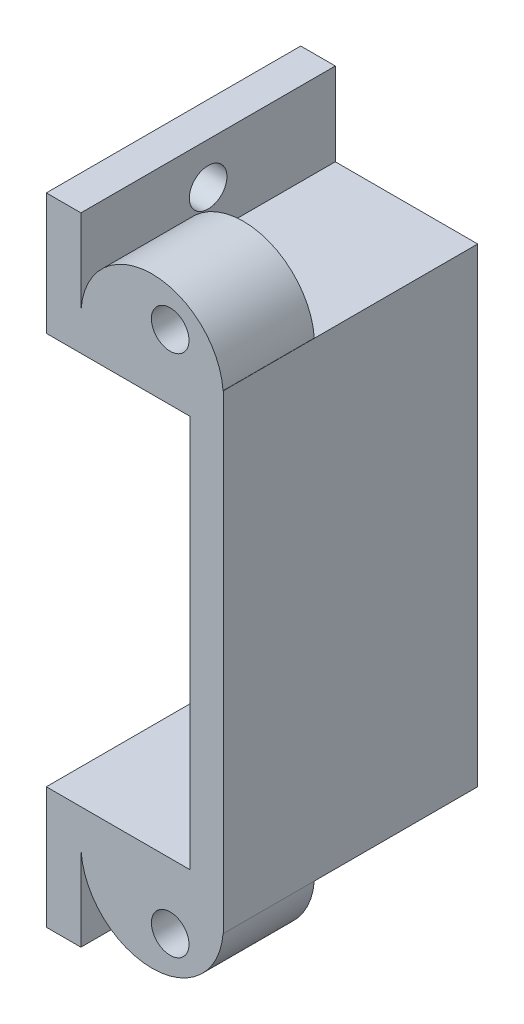
from build123d import *

# Parameters (mm, degrees)
BOSS_EXTRUDE1_DEPTH = 23
SKETCH2_R           = 1.7
CUT_EXTRUDE1_DEPTH  = 39.81958977
CUT_EXTRUDE5_START  = 23
SKETCH2_8_W         = 14.75
SKETCH2_8_H         = 7
SKETCH2_8_R         = 1.7
CUT_EXTRUDE5_DEPTH  = 23
SKETCH5_R           = 1.7
CUT_EXTRUDE6_DEPTH  = 41.323690307
SKETCH6_R           = 1.7
CUT_EXTRUDE7_DEPTH  = 23


with BuildPart() as part:
    # Sketch1 → Boss-Extrude1 (new body)
    with BuildSketch(Plane.XY):
        with BuildLine():
            Line((13, 18), (13, -18))
            Line((13, -18), (0, -18))
            Line((0, -18), (0, -28.5))
            Line((0, -28.5), (3.127139018, -28.5))
            Line((3.127139018, -28.5), (3.127139018, -21))
            Line((3.127139018, -21), (16, -21))
            Line((16, -21), (16, 21))
            ThreePointArc((16, 21), (9.563569509, 27.436430491), (3.127139018, 21))
            Line((3.127139018, 21), (3.127139018, 28.5))
            Line((3.127139018, 28.5), (0, 28.5))
            Line((0, 28.5), (0, 18))
            Line((0, 18), (13, 18))
        make_face()
    boss_extrude1 = extrude(amount=BOSS_EXTRUDE1_DEPTH)

    # Sketch2 → Cut-Extrude1 (cut, symmetric)
    with BuildSketch(Plane(origin=(3.127139018, 0, 0), x_dir=(0, 0, -1), z_dir=(1, 0, 0))):
        with Locations((-11.5, 24.75)):
            Circle(SKETCH2_R)
    cut_extrude1 = extrude(amount=CUT_EXTRUDE1_DEPTH, both=True, mode=Mode.SUBTRACT)

    # Sketch2<8> → Cut-Extrude5 (cut)
    with BuildSketch(Plane(origin=(3.127139018, 0, 0), x_dir=(0, 0, -1), z_dir=(1, 0, 0)).offset(CUT_EXTRUDE5_START)):
        with Locations((-7.375, 25)):
            Rectangle(SKETCH2_8_W, SKETCH2_8_H)
        with Locations((-11.5, 24.75)):
            Circle(SKETCH2_8_R, mode=Mode.SUBTRACT)
    cut_extrude5 = extrude(amount=-CUT_EXTRUDE5_DEPTH, mode=Mode.SUBTRACT)

    # Mirror5: Boss-Extrude1, Cut-Extrude1, Cut-Extrude5 across plane
    add(boss_extrude1.mirror(Plane(origin=(0, 0.25, 0), x_dir=(0, 0, 1), z_dir=(0, -1, 0))))
    add(cut_extrude1.mirror(Plane(origin=(0, 0.25, 0), x_dir=(0, 0, 1), z_dir=(0, -1, 0))), mode=Mode.SUBTRACT)
    add(cut_extrude5.mirror(Plane(origin=(0, 0.25, 0), x_dir=(0, 0, 1), z_dir=(0, -1, 0))), mode=Mode.SUBTRACT)

    # Sketch5 → Cut-Extrude6 (cut, through all)
    with BuildSketch(Plane.XY.offset(23)):
        with Locations((11.2, 23.9)):
            Circle(SKETCH5_R)
    cut_extrude6 = extrude(amount=-CUT_EXTRUDE6_DEPTH, mode=Mode.SUBTRACT)

    # Mirror8: Cut-Extrude6 across plane
    add(cut_extrude6.mirror(Plane(origin=(0, 0.25, 0), x_dir=(0, 0, 1), z_dir=(0, -1, 0))), mode=Mode.SUBTRACT)

    # Sketch6 → Cut-Extrude7 (cut)
    with BuildSketch(Plane(origin=(3.127139018, 0, 0), x_dir=(0, 0, -1), z_dir=(1, 0, 0))):
        with Locations((-11.5, 25.25)):
            Circle(SKETCH6_R)
    extrude(amount=-CUT_EXTRUDE7_DEPTH, mode=Mode.SUBTRACT)


solid = part.part
